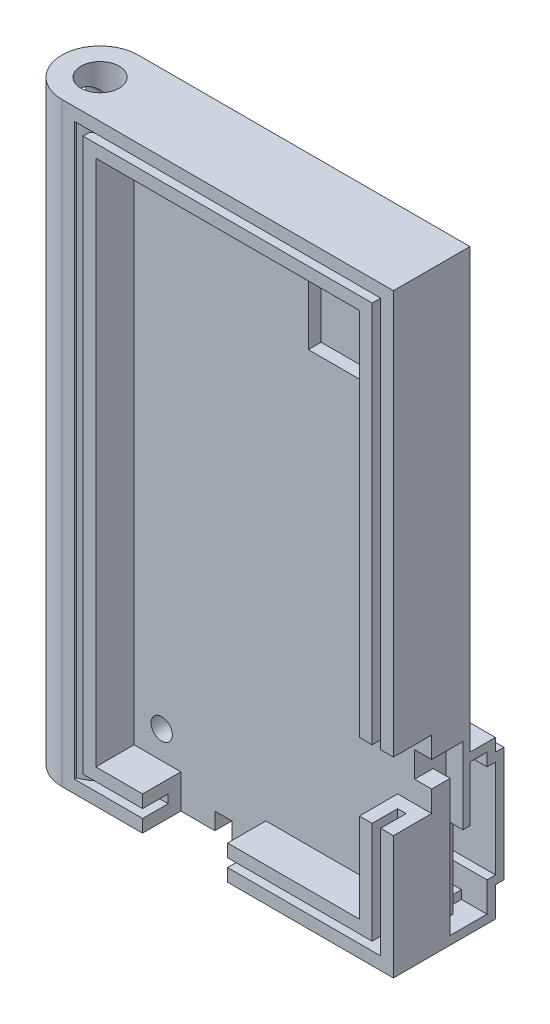
from build123d import *

# Parameters (mm, degrees)
SKETCH1_W                = 39
SKETCH1_H                = 70
BASE_DEPTH               = 4.5
SKETCH2_W                = 39
SKETCH2_H                = 70
SKETCH2_W_2              = 31
SKETCH2_H_2              = 62
WALLS_DEPTH              = 4.5
SKETCH3_W                = 10
SKETCH3_H                = 4.5
PWR_CONNECTOR_HOLE_DEPTH = 4
SKETCH4_W                = 4.5
SKETCH4_H                = 8
GPS_CONNECTOR_HOLE_DEPTH = 4
SKETCH5_R                = 1.25
MOUNTING_HOLES_DEPTH     = 4
SKETCH22_W               = 10.5
SKETCH22_H               = 11.5
ANTENNA_SPACE_DEPTH      = 1.5
GPS_MOUNT_DEPTH          = 3
SKETCH8_W                = 1
SKETCH8_H                = 1
GPS_RAILS_DEPTH          = 28
SKETCH9_W                = 1
SKETCH9_H                = 16.5
GPS_ROOF_DEPTH           = 14
SKETCH10_W               = 1
SKETCH10_H               = 1.5
SKETCH10_H_2             = 3.5
GPS_ROOF_2_DEPTH         = 17
SKETCH18_W               = 18
SKETCH18_H               = 1
CHIP_ROOF1_DEPTH         = 1
SKETCH19_W               = 18
SKETCH19_H               = 1
CHIP_ROOF2_DEPTH         = 12.5
SKETCH11_W               = 1
SKETCH11_H               = 3
PWR_CABLE_HOLDER1_DEPTH  = 3
PWR_CABLE_HOLDER2_DEPTH  = 2
GPS_CABLE_HOLDER_DEPTH   = 2
SKETCH14_W               = 36
SKETCH14_H               = 67
SKETCH14_W_2             = 34
SKETCH14_H_2             = 65
LID_MOUNT_DEPTH          = 3
SKETCH15_R               = 4.5
BALLON_MOUNT_DEPTH       = 70
SKETCH16_R               = 2.25
BALLOON_MOUNT_HOLE_DEPTH = 70
SKETCH17_W               = 2
SKETCH17_H               = 62
CORRECTION_DEPTH         = 4.5
SKETCH21_R               = 2.25
SAFETY_MOUNT_DEPTH       = 4.5


with BuildPart() as part:
    # Sketch1 → Base (new body)
    with BuildSketch(Plane.XY):
        with Locations((19.5, 35)):
            Rectangle(SKETCH1_W, SKETCH1_H)
    extrude(amount=BASE_DEPTH)

    # Sketch2 → Walls (add)
    with BuildSketch(Plane.XY.offset(4.5)):
        with Locations((19.5, 35)):
            Rectangle(SKETCH2_W, SKETCH2_H)
        with Locations((19.5, 35)):
            Rectangle(SKETCH2_W_2, SKETCH2_H_2, mode=Mode.SUBTRACT)
    extrude(amount=WALLS_DEPTH)

    # Sketch3 → PWR connector hole (cut)
    with BuildSketch(Plane(origin=(0, 4, 0), x_dir=(1, 0, 0), z_dir=(0, 1, 0))):
        with Locations((14.5, -6.75)):
            Rectangle(SKETCH3_W, SKETCH3_H)
    extrude(amount=-PWR_CONNECTOR_HOLE_DEPTH, mode=Mode.SUBTRACT)

    # Sketch4 → GPS connector hole (cut)
    with BuildSketch(Plane.ZY.offset(-35)):
        with Locations((6.75, 18.5)):
            Rectangle(SKETCH4_W, SKETCH4_H)
    extrude(amount=-GPS_CONNECTOR_HOLE_DEPTH, mode=Mode.SUBTRACT)

    # Sketch5 → Mounting holes (cut)
    with BuildSketch(Plane.XY.offset(4.5)):
        with Locations((7.25, 7.25)):
            Circle(SKETCH5_R)
        with Locations((31.75, 7.25)):
            Circle(SKETCH5_R)
        with Locations((7.25, 62.75)):
            Circle(SKETCH5_R)
    extrude(amount=-MOUNTING_HOLES_DEPTH, mode=Mode.SUBTRACT)

    # Sketch22 → Antenna space (cut)
    with BuildSketch(Plane.XY.offset(4.5)):
        with Locations((29.75, 60.25)):
            Rectangle(SKETCH22_W, SKETCH22_H)
    extrude(amount=-ANTENNA_SPACE_DEPTH, mode=Mode.SUBTRACT)

    # Sketch7 → GPS mount (add)
    with BuildSketch(Plane(origin=(0, 0, 0), x_dir=(-1, 0, 0), z_dir=(0, 0, -1))):
        Polygon((-8, 1), (-39, 1), (-39, 0), (-7, 0), (-7, 18.5), (-39, 18.5), (-39, 17.5), (-8, 17.5), align=None)
    extrude(amount=GPS_MOUNT_DEPTH)

    # Sketch8 → GPS rails (add)
    with BuildSketch(Plane(origin=(8, 0, 0), x_dir=(0, 0, -1), z_dir=(1, 0, 0))):
        with Locations((1.5, 17)):
            Rectangle(SKETCH8_W, SKETCH8_H)
        with Locations((1.5, 1.5)):
            Rectangle(SKETCH8_W, SKETCH8_H)
    extrude(amount=GPS_RAILS_DEPTH)

    # Sketch9 → GPS _roof (add)
    with BuildSketch(Plane(origin=(8, 0, 0), x_dir=(0, 0, -1), z_dir=(1, 0, 0))):
        with Locations((2.5, 9.25)):
            Rectangle(SKETCH9_W, SKETCH9_H)
    extrude(amount=GPS_ROOF_DEPTH)

    # Sketch10 → GPS _roof 2 (add)
    with BuildSketch(Plane(origin=(22, 0, 0), x_dir=(0, 0, -1), z_dir=(1, 0, 0))):
        with Locations((2.5, 16.75)):
            Rectangle(SKETCH10_W, SKETCH10_H)
        with Locations((2.5, 2.75)):
            Rectangle(SKETCH10_W, SKETCH10_H_2)
    extrude(amount=GPS_ROOF_2_DEPTH)

    # Sketch18 → Chip roof1 (add)
    with BuildSketch(Plane(origin=(0, 0, -3), x_dir=(-1, 0, 0), z_dir=(0, 0, -1))):
        with Locations((-30, 4)):
            Rectangle(SKETCH18_W, SKETCH18_H)
    extrude(amount=CHIP_ROOF1_DEPTH)

    # Sketch19 → Chip roof2 (add)
    with BuildSketch(Plane(origin=(0, 4.5, 0), x_dir=(1, 0, 0), z_dir=(0, 1, 0))):
        with Locations((30, 3.5)):
            Rectangle(SKETCH19_W, SKETCH19_H)
    extrude(amount=CHIP_ROOF2_DEPTH)

    # Sketch11 → PWR cable holder1 (add)
    with BuildSketch(Plane(origin=(0, 0, 0), x_dir=(-1, 0, 0), z_dir=(0, 0, -1))):
        Polygon((-5, 0), (-4, 0), (-4, 21.5), (-22, 21.5), (-22, 20.5), (-5, 20.5), align=None)
        with Locations((-27.5, 20)):
            Rectangle(SKETCH11_W, SKETCH11_H)
    extrude(amount=PWR_CABLE_HOLDER1_DEPTH)

    # Sketch12 → PWR cable holder2 (cut)
    with BuildSketch(Plane.XZ):
        Polygon((5, 2), (5, 0), (15.5, 0), (15.5, 4.5), (13.5, 4.5), (13.5, 2), align=None)
    extrude(amount=-PWR_CABLE_HOLDER2_DEPTH, mode=Mode.SUBTRACT)

    # Sketch13 → GPS cable holder (cut)
    with BuildSketch(Plane(origin=(39, 0, 0), x_dir=(0, 0, -1), z_dir=(1, 0, 0))):
        Polygon((-4.5, 20), (-4.5, 17), (-2.326586719, 17), (-2.326586719, 1), (0, 1), (0, 11), (-0.826586719, 11), (-0.826586719, 20), align=None)
    extrude(amount=-GPS_CABLE_HOLDER_DEPTH, mode=Mode.SUBTRACT)

    # Sketch14 → Lid mount (cut)
    with BuildSketch(Plane.XY.offset(9)):
        with Locations((19.5, 35)):
            Rectangle(SKETCH14_W, SKETCH14_H)
        with Locations((19.5, 35)):
            Rectangle(SKETCH14_W_2, SKETCH14_H_2, mode=Mode.SUBTRACT)
    extrude(amount=-LID_MOUNT_DEPTH, mode=Mode.SUBTRACT)

    # Sketch15 → Ballon mount (add)
    with BuildSketch(Plane.XZ):
        with Locations((0, 4.5)):
            Circle(SKETCH15_R)
    extrude(amount=-BALLON_MOUNT_DEPTH)

    # Sketch16 → Balloon mount hole (cut)
    with BuildSketch(Plane.XZ):
        with Locations((0, 4.5)):
            Circle(SKETCH16_R)
    extrude(amount=-BALLOON_MOUNT_HOLE_DEPTH, mode=Mode.SUBTRACT)

    # Sketch17 → Correction (cut)
    with BuildSketch(Plane.XY.offset(9)):
        with Locations((5, 35)):
            Rectangle(SKETCH17_W, SKETCH17_H)
    extrude(amount=-CORRECTION_DEPTH, mode=Mode.SUBTRACT)

    # Sketch21 → Safety mount (cut)
    with BuildSketch(Plane.ZY.offset(4.5)):
        with Locations((4.5, 4.5)):
            Circle(SKETCH21_R)
        with Locations((4.5, 65.5)):
            Circle(SKETCH21_R)
    extrude(amount=-SAFETY_MOUNT_DEPTH, mode=Mode.SUBTRACT)


solid = part.part
